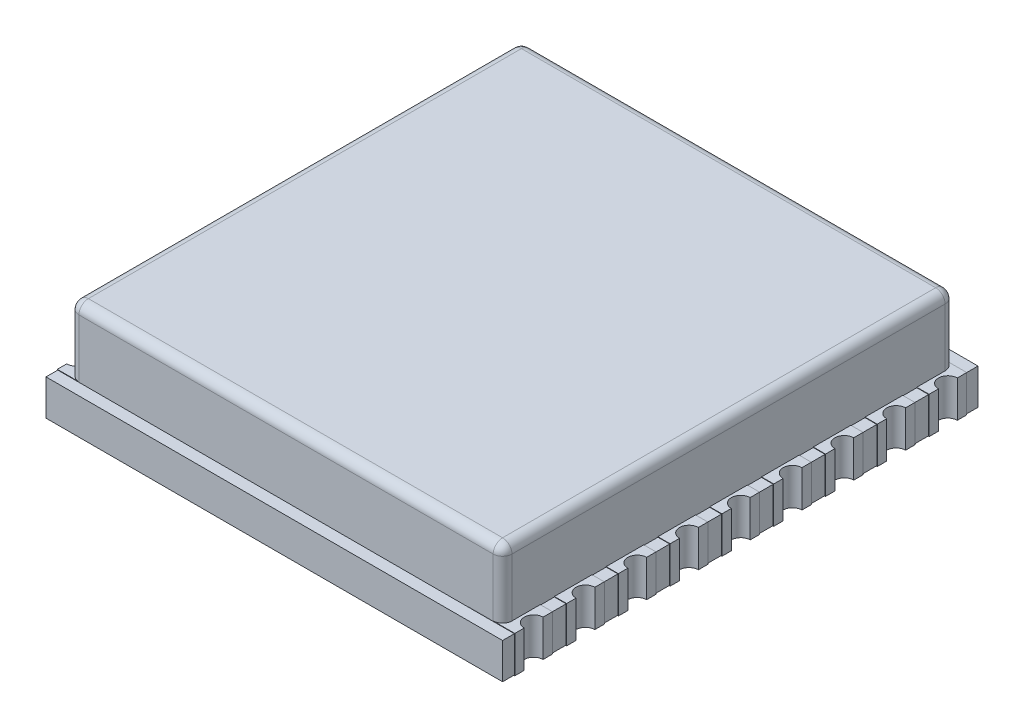
from build123d import *

# Parameters (mm, degrees)
SKETCH1_W              = 9.7
SKETCH1_H              = 10.1
BOSS_EXTRUDE1_DEPTH    = 0.76
CUT_EXTRUDE1_REACH     = 9.043
SKETCH2_R              = 0.25
BOSS_EXTRUDE2_START    = 0.01
SKETCH3_W              = 1
SKETCH3_H              = 0.8
BOSS_EXTRUDE2_DEPTH    = 0.78
BOSS_EXTRUDE2_2_DEPTH  = 0.78
BOSS_EXTRUDE2_3_DEPTH  = 0.78
BOSS_EXTRUDE2_4_DEPTH  = 0.78
BOSS_EXTRUDE2_5_DEPTH  = 0.78
BOSS_EXTRUDE2_6_DEPTH  = 0.78
BOSS_EXTRUDE2_7_DEPTH  = 0.78
BOSS_EXTRUDE2_8_DEPTH  = 0.78
BOSS_EXTRUDE2_9_DEPTH  = 0.78
BOSS_EXTRUDE2_10_DEPTH = 0.78
BOSS_EXTRUDE2_11_DEPTH = 0.78
BOSS_EXTRUDE2_12_DEPTH = 0.78
BOSS_EXTRUDE2_13_DEPTH = 0.78
BOSS_EXTRUDE2_14_DEPTH = 0.78
BOSS_EXTRUDE2_15_DEPTH = 0.78
BOSS_EXTRUDE2_16_DEPTH = 0.78
BOSS_EXTRUDE2_17_DEPTH = 0.78
BOSS_EXTRUDE2_18_DEPTH = 0.78
SKETCH4_R              = 0.2
CUT_EXTRUDE2_DEPTH     = 8.051985536
SKETCH5_W              = 9.2
SKETCH5_H              = 9.6
BOSS_EXTRUDE3_DEPTH    = 1.44
FILLET1_R              = 0.2
SHELL1_START           = -4.6
SHELL1_OUTLINE_W       = 8.8
SHELL1_OUTLINE_H       = 1.24
SHELL1_DEPTH           = 9.2


# Read off the part's stored shape, not the designer's step: Shell1
with BuildPart() as part:
    # Sketch1 → Boss-Extrude1 (new body)
    with BuildSketch(Plane(origin=(0, 0, 0), x_dir=(1, 0, 0), z_dir=(0, 1, 0))):
        Rectangle(SKETCH1_W, SKETCH1_H)
    extrude(amount=BOSS_EXTRUDE1_DEPTH)

    # Sketch2 → Cut-Extrude1 (cut, up to next)
    with BuildSketch(Plane(origin=(0, 0.76, 0), x_dir=(1, 0, 0), z_dir=(0, 1, 0)), mode=Mode.PRIVATE) as cut_extrude1_sk1:
        with Locations((-4.85, 4.4)):
            Circle(SKETCH2_R)
    cut_extrude1_tool1 = extrude(cut_extrude1_sk1.sketch, amount=-CUT_EXTRUDE1_REACH, mode=Mode.PRIVATE) & part.part
    # Sketch2 → Cut-Extrude1 (cut, up to next)
    with BuildSketch(Plane(origin=(0, 0.76, 0), x_dir=(1, 0, 0), z_dir=(0, 1, 0)), mode=Mode.PRIVATE) as cut_extrude1_sk2:
        with Locations((-4.85, 3.3)):
            Circle(SKETCH2_R)
    cut_extrude1_tool2 = extrude(cut_extrude1_sk2.sketch, amount=-CUT_EXTRUDE1_REACH, mode=Mode.PRIVATE) & part.part
    # Sketch2 → Cut-Extrude1 (cut, up to next)
    with BuildSketch(Plane(origin=(0, 0.76, 0), x_dir=(1, 0, 0), z_dir=(0, 1, 0)), mode=Mode.PRIVATE) as cut_extrude1_sk3:
        with Locations((-4.85, 2.2)):
            Circle(SKETCH2_R)
    cut_extrude1_tool3 = extrude(cut_extrude1_sk3.sketch, amount=-CUT_EXTRUDE1_REACH, mode=Mode.PRIVATE) & part.part
    # Sketch2 → Cut-Extrude1 (cut, up to next)
    with BuildSketch(Plane(origin=(0, 0.76, 0), x_dir=(1, 0, 0), z_dir=(0, 1, 0)), mode=Mode.PRIVATE) as cut_extrude1_sk4:
        with Locations((-4.85, 1.1)):
            Circle(SKETCH2_R)
    cut_extrude1_tool4 = extrude(cut_extrude1_sk4.sketch, amount=-CUT_EXTRUDE1_REACH, mode=Mode.PRIVATE) & part.part
    # Sketch2 → Cut-Extrude1 (cut, up to next)
    with BuildSketch(Plane(origin=(0, 0.76, 0), x_dir=(1, 0, 0), z_dir=(0, 1, 0)), mode=Mode.PRIVATE) as cut_extrude1_sk5:
        with Locations((-4.85, 0)):
            Circle(SKETCH2_R)
    cut_extrude1_tool5 = extrude(cut_extrude1_sk5.sketch, amount=-CUT_EXTRUDE1_REACH, mode=Mode.PRIVATE) & part.part
    # Sketch2 → Cut-Extrude1 (cut, up to next)
    with BuildSketch(Plane(origin=(0, 0.76, 0), x_dir=(1, 0, 0), z_dir=(0, 1, 0)), mode=Mode.PRIVATE) as cut_extrude1_sk6:
        with Locations((-4.85, -1.1)):
            Circle(SKETCH2_R)
    cut_extrude1_tool6 = extrude(cut_extrude1_sk6.sketch, amount=-CUT_EXTRUDE1_REACH, mode=Mode.PRIVATE) & part.part
    # Sketch2 → Cut-Extrude1 (cut, up to next)
    with BuildSketch(Plane(origin=(0, 0.76, 0), x_dir=(1, 0, 0), z_dir=(0, 1, 0)), mode=Mode.PRIVATE) as cut_extrude1_sk7:
        with Locations((-4.85, -2.2)):
            Circle(SKETCH2_R)
    cut_extrude1_tool7 = extrude(cut_extrude1_sk7.sketch, amount=-CUT_EXTRUDE1_REACH, mode=Mode.PRIVATE) & part.part
    # Sketch2 → Cut-Extrude1 (cut, up to next)
    with BuildSketch(Plane(origin=(0, 0.76, 0), x_dir=(1, 0, 0), z_dir=(0, 1, 0)), mode=Mode.PRIVATE) as cut_extrude1_sk8:
        with Locations((-4.85, -3.3)):
            Circle(SKETCH2_R)
    cut_extrude1_tool8 = extrude(cut_extrude1_sk8.sketch, amount=-CUT_EXTRUDE1_REACH, mode=Mode.PRIVATE) & part.part
    # Sketch2 → Cut-Extrude1 (cut, up to next)
    with BuildSketch(Plane(origin=(0, 0.76, 0), x_dir=(1, 0, 0), z_dir=(0, 1, 0)), mode=Mode.PRIVATE) as cut_extrude1_sk9:
        with Locations((-4.85, -4.4)):
            Circle(SKETCH2_R)
    cut_extrude1_tool9 = extrude(cut_extrude1_sk9.sketch, amount=-CUT_EXTRUDE1_REACH, mode=Mode.PRIVATE) & part.part
    # Sketch2 → Cut-Extrude1 (cut, up to next)
    with BuildSketch(Plane(origin=(0, 0.76, 0), x_dir=(1, 0, 0), z_dir=(0, 1, 0)), mode=Mode.PRIVATE) as cut_extrude1_sk10:
        with Locations((4.85, -4.4)):
            Circle(SKETCH2_R)
    cut_extrude1_tool10 = extrude(cut_extrude1_sk10.sketch, amount=-CUT_EXTRUDE1_REACH, mode=Mode.PRIVATE) & part.part
    # Sketch2 → Cut-Extrude1 (cut, up to next)
    with BuildSketch(Plane(origin=(0, 0.76, 0), x_dir=(1, 0, 0), z_dir=(0, 1, 0)), mode=Mode.PRIVATE) as cut_extrude1_sk11:
        with Locations((4.85, -3.3)):
            Circle(SKETCH2_R)
    cut_extrude1_tool11 = extrude(cut_extrude1_sk11.sketch, amount=-CUT_EXTRUDE1_REACH, mode=Mode.PRIVATE) & part.part
    # Sketch2 → Cut-Extrude1 (cut, up to next)
    with BuildSketch(Plane(origin=(0, 0.76, 0), x_dir=(1, 0, 0), z_dir=(0, 1, 0)), mode=Mode.PRIVATE) as cut_extrude1_sk12:
        with Locations((4.85, -2.2)):
            Circle(SKETCH2_R)
    cut_extrude1_tool12 = extrude(cut_extrude1_sk12.sketch, amount=-CUT_EXTRUDE1_REACH, mode=Mode.PRIVATE) & part.part
    # Sketch2 → Cut-Extrude1 (cut, up to next)
    with BuildSketch(Plane(origin=(0, 0.76, 0), x_dir=(1, 0, 0), z_dir=(0, 1, 0)), mode=Mode.PRIVATE) as cut_extrude1_sk13:
        with Locations((4.85, -1.1)):
            Circle(SKETCH2_R)
    cut_extrude1_tool13 = extrude(cut_extrude1_sk13.sketch, amount=-CUT_EXTRUDE1_REACH, mode=Mode.PRIVATE) & part.part
    # Sketch2 → Cut-Extrude1 (cut, up to next)
    with BuildSketch(Plane(origin=(0, 0.76, 0), x_dir=(1, 0, 0), z_dir=(0, 1, 0)), mode=Mode.PRIVATE) as cut_extrude1_sk14:
        with Locations((4.85, 0)):
            Circle(SKETCH2_R)
    cut_extrude1_tool14 = extrude(cut_extrude1_sk14.sketch, amount=-CUT_EXTRUDE1_REACH, mode=Mode.PRIVATE) & part.part
    # Sketch2 → Cut-Extrude1 (cut, up to next)
    with BuildSketch(Plane(origin=(0, 0.76, 0), x_dir=(1, 0, 0), z_dir=(0, 1, 0)), mode=Mode.PRIVATE) as cut_extrude1_sk15:
        with Locations((4.85, 1.1)):
            Circle(SKETCH2_R)
    cut_extrude1_tool15 = extrude(cut_extrude1_sk15.sketch, amount=-CUT_EXTRUDE1_REACH, mode=Mode.PRIVATE) & part.part
    # Sketch2 → Cut-Extrude1 (cut, up to next)
    with BuildSketch(Plane(origin=(0, 0.76, 0), x_dir=(1, 0, 0), z_dir=(0, 1, 0)), mode=Mode.PRIVATE) as cut_extrude1_sk16:
        with Locations((4.85, 2.2)):
            Circle(SKETCH2_R)
    cut_extrude1_tool16 = extrude(cut_extrude1_sk16.sketch, amount=-CUT_EXTRUDE1_REACH, mode=Mode.PRIVATE) & part.part
    # Sketch2 → Cut-Extrude1 (cut, up to next)
    with BuildSketch(Plane(origin=(0, 0.76, 0), x_dir=(1, 0, 0), z_dir=(0, 1, 0)), mode=Mode.PRIVATE) as cut_extrude1_sk17:
        with Locations((4.85, 3.3)):
            Circle(SKETCH2_R)
    cut_extrude1_tool17 = extrude(cut_extrude1_sk17.sketch, amount=-CUT_EXTRUDE1_REACH, mode=Mode.PRIVATE) & part.part
    # Sketch2 → Cut-Extrude1 (cut, up to next)
    with BuildSketch(Plane(origin=(0, 0.76, 0), x_dir=(1, 0, 0), z_dir=(0, 1, 0)), mode=Mode.PRIVATE) as cut_extrude1_sk18:
        with Locations((4.85, 4.4)):
            Circle(SKETCH2_R)
    cut_extrude1_tool18 = extrude(cut_extrude1_sk18.sketch, amount=-CUT_EXTRUDE1_REACH, mode=Mode.PRIVATE) & part.part
    add(cut_extrude1_tool1.solids().sort_by_distance((-4.85, 0.76, -4.4))[0], mode=Mode.SUBTRACT)
    add(cut_extrude1_tool2.solids().sort_by_distance((-4.85, 0.76, -3.3))[0], mode=Mode.SUBTRACT)
    add(cut_extrude1_tool3.solids().sort_by_distance((-4.85, 0.76, -2.2))[0], mode=Mode.SUBTRACT)
    add(cut_extrude1_tool4.solids().sort_by_distance((-4.85, 0.76, -1.1))[0], mode=Mode.SUBTRACT)
    add(cut_extrude1_tool5.solids().sort_by_distance((-4.85, 0.76, 0))[0], mode=Mode.SUBTRACT)
    add(cut_extrude1_tool6.solids().sort_by_distance((-4.85, 0.76, 1.1))[0], mode=Mode.SUBTRACT)
    add(cut_extrude1_tool7.solids().sort_by_distance((-4.85, 0.76, 2.2))[0], mode=Mode.SUBTRACT)
    add(cut_extrude1_tool8.solids().sort_by_distance((-4.85, 0.76, 3.3))[0], mode=Mode.SUBTRACT)
    add(cut_extrude1_tool9.solids().sort_by_distance((-4.85, 0.76, 4.4))[0], mode=Mode.SUBTRACT)
    add(cut_extrude1_tool10.solids().sort_by_distance((4.85, 0.76, 4.4))[0], mode=Mode.SUBTRACT)
    add(cut_extrude1_tool11.solids().sort_by_distance((4.85, 0.76, 3.3))[0], mode=Mode.SUBTRACT)
    add(cut_extrude1_tool12.solids().sort_by_distance((4.85, 0.76, 2.2))[0], mode=Mode.SUBTRACT)
    add(cut_extrude1_tool13.solids().sort_by_distance((4.85, 0.76, 1.1))[0], mode=Mode.SUBTRACT)
    add(cut_extrude1_tool14.solids().sort_by_distance((4.85, 0.76, 0))[0], mode=Mode.SUBTRACT)
    add(cut_extrude1_tool15.solids().sort_by_distance((4.85, 0.76, -1.1))[0], mode=Mode.SUBTRACT)
    add(cut_extrude1_tool16.solids().sort_by_distance((4.85, 0.76, -2.2))[0], mode=Mode.SUBTRACT)
    add(cut_extrude1_tool17.solids().sort_by_distance((4.85, 0.76, -3.3))[0], mode=Mode.SUBTRACT)
    add(cut_extrude1_tool18.solids().sort_by_distance((4.85, 0.76, -4.4))[0], mode=Mode.SUBTRACT)


with BuildPart() as body_2:
    # Sketch3 → Boss-Extrude2 (new body)
    with BuildSketch(Plane(origin=(0, 0.76, 0), x_dir=(1, 0, 0), z_dir=(0, 1, 0)).offset(BOSS_EXTRUDE2_START)):
        with Locations((-4.36, 4.4)):
            Rectangle(SKETCH3_W, SKETCH3_H)
    extrude(amount=-BOSS_EXTRUDE2_DEPTH)


with BuildPart() as body_3:
    # Sketch3 → Boss-Extrude2 2 (new body)
    with BuildSketch(Plane(origin=(0, 0.76, 0), x_dir=(1, 0, 0), z_dir=(0, 1, 0)).offset(BOSS_EXTRUDE2_START)):
        with Locations((-4.36, 3.3)):
            Rectangle(SKETCH3_W, SKETCH3_H)
    extrude(amount=-BOSS_EXTRUDE2_2_DEPTH)


with BuildPart() as body_4:
    # Sketch3 → Boss-Extrude2 3 (new body)
    with BuildSketch(Plane(origin=(0, 0.76, 0), x_dir=(1, 0, 0), z_dir=(0, 1, 0)).offset(BOSS_EXTRUDE2_START)):
        with Locations((-4.36, 2.2)):
            Rectangle(SKETCH3_W, SKETCH3_H)
    extrude(amount=-BOSS_EXTRUDE2_3_DEPTH)


with BuildPart() as body_5:
    # Sketch3 → Boss-Extrude2 4 (new body)
    with BuildSketch(Plane(origin=(0, 0.76, 0), x_dir=(1, 0, 0), z_dir=(0, 1, 0)).offset(BOSS_EXTRUDE2_START)):
        with Locations((-4.36, 1.1)):
            Rectangle(SKETCH3_W, SKETCH3_H)
    extrude(amount=-BOSS_EXTRUDE2_4_DEPTH)


with BuildPart() as body_6:
    # Sketch3 → Boss-Extrude2 5 (new body)
    with BuildSketch(Plane(origin=(0, 0.76, 0), x_dir=(1, 0, 0), z_dir=(0, 1, 0)).offset(BOSS_EXTRUDE2_START)):
        with Locations((-4.36, 0)):
            Rectangle(SKETCH3_W, SKETCH3_H)
    extrude(amount=-BOSS_EXTRUDE2_5_DEPTH)


with BuildPart() as body_7:
    # Sketch3 → Boss-Extrude2 6 (new body)
    with BuildSketch(Plane(origin=(0, 0.76, 0), x_dir=(1, 0, 0), z_dir=(0, 1, 0)).offset(BOSS_EXTRUDE2_START)):
        with Locations((-4.36, -1.1)):
            Rectangle(SKETCH3_W, SKETCH3_H)
    extrude(amount=-BOSS_EXTRUDE2_6_DEPTH)


with BuildPart() as body_8:
    # Sketch3 → Boss-Extrude2 7 (new body)
    with BuildSketch(Plane(origin=(0, 0.76, 0), x_dir=(1, 0, 0), z_dir=(0, 1, 0)).offset(BOSS_EXTRUDE2_START)):
        with Locations((-4.36, -2.2)):
            Rectangle(SKETCH3_W, SKETCH3_H)
    extrude(amount=-BOSS_EXTRUDE2_7_DEPTH)


with BuildPart() as body_9:
    # Sketch3 → Boss-Extrude2 8 (new body)
    with BuildSketch(Plane(origin=(0, 0.76, 0), x_dir=(1, 0, 0), z_dir=(0, 1, 0)).offset(BOSS_EXTRUDE2_START)):
        with Locations((-4.36, -3.3)):
            Rectangle(SKETCH3_W, SKETCH3_H)
    extrude(amount=-BOSS_EXTRUDE2_8_DEPTH)


with BuildPart() as body_10:
    # Sketch3 → Boss-Extrude2 9 (new body)
    with BuildSketch(Plane(origin=(0, 0.76, 0), x_dir=(1, 0, 0), z_dir=(0, 1, 0)).offset(BOSS_EXTRUDE2_START)):
        with Locations((-4.36, -4.4)):
            Rectangle(SKETCH3_W, SKETCH3_H)
    extrude(amount=-BOSS_EXTRUDE2_9_DEPTH)


with BuildPart() as body_11:
    # Sketch3 → Boss-Extrude2 10 (new body)
    with BuildSketch(Plane(origin=(0, 0.76, 0), x_dir=(1, 0, 0), z_dir=(0, 1, 0)).offset(BOSS_EXTRUDE2_START)):
        with Locations((4.36, -4.4)):
            Rectangle(SKETCH3_W, SKETCH3_H)
    extrude(amount=-BOSS_EXTRUDE2_10_DEPTH)


with BuildPart() as body_12:
    # Sketch3 → Boss-Extrude2 11 (new body)
    with BuildSketch(Plane(origin=(0, 0.76, 0), x_dir=(1, 0, 0), z_dir=(0, 1, 0)).offset(BOSS_EXTRUDE2_START)):
        with Locations((4.36, -3.3)):
            Rectangle(SKETCH3_W, SKETCH3_H)
    extrude(amount=-BOSS_EXTRUDE2_11_DEPTH)


with BuildPart() as body_13:
    # Sketch3 → Boss-Extrude2 12 (new body)
    with BuildSketch(Plane(origin=(0, 0.76, 0), x_dir=(1, 0, 0), z_dir=(0, 1, 0)).offset(BOSS_EXTRUDE2_START)):
        with Locations((4.36, -2.2)):
            Rectangle(SKETCH3_W, SKETCH3_H)
    extrude(amount=-BOSS_EXTRUDE2_12_DEPTH)


with BuildPart() as body_14:
    # Sketch3 → Boss-Extrude2 13 (new body)
    with BuildSketch(Plane(origin=(0, 0.76, 0), x_dir=(1, 0, 0), z_dir=(0, 1, 0)).offset(BOSS_EXTRUDE2_START)):
        with Locations((4.36, -1.1)):
            Rectangle(SKETCH3_W, SKETCH3_H)
    extrude(amount=-BOSS_EXTRUDE2_13_DEPTH)


with BuildPart() as body_15:
    # Sketch3 → Boss-Extrude2 14 (new body)
    with BuildSketch(Plane(origin=(0, 0.76, 0), x_dir=(1, 0, 0), z_dir=(0, 1, 0)).offset(BOSS_EXTRUDE2_START)):
        with Locations((4.36, 0)):
            Rectangle(SKETCH3_W, SKETCH3_H)
    extrude(amount=-BOSS_EXTRUDE2_14_DEPTH)


with BuildPart() as body_16:
    # Sketch3 → Boss-Extrude2 15 (new body)
    with BuildSketch(Plane(origin=(0, 0.76, 0), x_dir=(1, 0, 0), z_dir=(0, 1, 0)).offset(BOSS_EXTRUDE2_START)):
        with Locations((4.36, 1.1)):
            Rectangle(SKETCH3_W, SKETCH3_H)
    extrude(amount=-BOSS_EXTRUDE2_15_DEPTH)


with BuildPart() as body_17:
    # Sketch3 → Boss-Extrude2 16 (new body)
    with BuildSketch(Plane(origin=(0, 0.76, 0), x_dir=(1, 0, 0), z_dir=(0, 1, 0)).offset(BOSS_EXTRUDE2_START)):
        with Locations((4.36, 2.2)):
            Rectangle(SKETCH3_W, SKETCH3_H)
    extrude(amount=-BOSS_EXTRUDE2_16_DEPTH)


with BuildPart() as body_18:
    # Sketch3 → Boss-Extrude2 17 (new body)
    with BuildSketch(Plane(origin=(0, 0.76, 0), x_dir=(1, 0, 0), z_dir=(0, 1, 0)).offset(BOSS_EXTRUDE2_START)):
        with Locations((4.36, 3.3)):
            Rectangle(SKETCH3_W, SKETCH3_H)
    extrude(amount=-BOSS_EXTRUDE2_17_DEPTH)


with BuildPart() as body_19:
    # Sketch3 → Boss-Extrude2 18 (new body)
    with BuildSketch(Plane(origin=(0, 0.76, 0), x_dir=(1, 0, 0), z_dir=(0, 1, 0)).offset(BOSS_EXTRUDE2_START)):
        with Locations((4.36, 4.4)):
            Rectangle(SKETCH3_W, SKETCH3_H)
    extrude(amount=-BOSS_EXTRUDE2_18_DEPTH)


with BuildPart() as cut_extrude2_tool:
    # Sketch4 → Cut-Extrude2 (new, through all)
    with BuildSketch(Plane(origin=(0, 0.77, 0), x_dir=(1, 0, 0), z_dir=(0, 1, 0))):
        with Locations((-4.86, 4.4)):
            Circle(SKETCH4_R)
        with Locations((-4.86, 3.3)):
            Circle(SKETCH4_R)
        with Locations((-4.86, 2.2)):
            Circle(SKETCH4_R)
        with Locations((-4.86, 1.1)):
            Circle(SKETCH4_R)
        with Locations((-4.86, 0)):
            Circle(SKETCH4_R)
        with Locations((-4.86, -1.1)):
            Circle(SKETCH4_R)
        with Locations((-4.86, -2.2)):
            Circle(SKETCH4_R)
        with Locations((-4.86, -3.3)):
            Circle(SKETCH4_R)
        with Locations((-4.86, -4.4)):
            Circle(SKETCH4_R)
        with Locations((4.86, -4.4)):
            Circle(SKETCH4_R)
        with Locations((4.86, -3.3)):
            Circle(SKETCH4_R)
        with Locations((4.86, -2.2)):
            Circle(SKETCH4_R)
        with Locations((4.86, -1.1)):
            Circle(SKETCH4_R)
        with Locations((4.86, 0)):
            Circle(SKETCH4_R)
        with Locations((4.86, 1.1)):
            Circle(SKETCH4_R)
        with Locations((4.86, 2.2)):
            Circle(SKETCH4_R)
        with Locations((4.86, 3.3)):
            Circle(SKETCH4_R)
        with Locations((4.86, 4.4)):
            Circle(SKETCH4_R)
    extrude(amount=-CUT_EXTRUDE2_DEPTH)


with BuildPart() as body_2_1:
    add(body_2.part)

    # Cut-Extrude2: cut by cut_extrude2_tool
    add(cut_extrude2_tool.part, mode=Mode.SUBTRACT)


with BuildPart() as body_3_1:
    add(body_3.part)

    # Cut-Extrude2: cut by cut_extrude2_tool
    add(cut_extrude2_tool.part, mode=Mode.SUBTRACT)


with BuildPart() as body_4_1:
    add(body_4.part)

    # Cut-Extrude2: cut by cut_extrude2_tool
    add(cut_extrude2_tool.part, mode=Mode.SUBTRACT)


with BuildPart() as body_5_1:
    add(body_5.part)

    # Cut-Extrude2: cut by cut_extrude2_tool
    add(cut_extrude2_tool.part, mode=Mode.SUBTRACT)


with BuildPart() as body_6_1:
    add(body_6.part)

    # Cut-Extrude2: cut by cut_extrude2_tool
    add(cut_extrude2_tool.part, mode=Mode.SUBTRACT)


with BuildPart() as body_7_1:
    add(body_7.part)

    # Cut-Extrude2: cut by cut_extrude2_tool
    add(cut_extrude2_tool.part, mode=Mode.SUBTRACT)


with BuildPart() as body_8_1:
    add(body_8.part)

    # Cut-Extrude2: cut by cut_extrude2_tool
    add(cut_extrude2_tool.part, mode=Mode.SUBTRACT)


with BuildPart() as body_9_1:
    add(body_9.part)

    # Cut-Extrude2: cut by cut_extrude2_tool
    add(cut_extrude2_tool.part, mode=Mode.SUBTRACT)


with BuildPart() as body_10_1:
    add(body_10.part)

    # Cut-Extrude2: cut by cut_extrude2_tool
    add(cut_extrude2_tool.part, mode=Mode.SUBTRACT)


with BuildPart() as body_11_1:
    add(body_11.part)

    # Cut-Extrude2: cut by cut_extrude2_tool
    add(cut_extrude2_tool.part, mode=Mode.SUBTRACT)


with BuildPart() as body_12_1:
    add(body_12.part)

    # Cut-Extrude2: cut by cut_extrude2_tool
    add(cut_extrude2_tool.part, mode=Mode.SUBTRACT)


with BuildPart() as body_13_1:
    add(body_13.part)

    # Cut-Extrude2: cut by cut_extrude2_tool
    add(cut_extrude2_tool.part, mode=Mode.SUBTRACT)


with BuildPart() as body_14_1:
    add(body_14.part)

    # Cut-Extrude2: cut by cut_extrude2_tool
    add(cut_extrude2_tool.part, mode=Mode.SUBTRACT)


with BuildPart() as body_15_1:
    add(body_15.part)

    # Cut-Extrude2: cut by cut_extrude2_tool
    add(cut_extrude2_tool.part, mode=Mode.SUBTRACT)


with BuildPart() as body_16_1:
    add(body_16.part)

    # Cut-Extrude2: cut by cut_extrude2_tool
    add(cut_extrude2_tool.part, mode=Mode.SUBTRACT)


with BuildPart() as body_17_1:
    add(body_17.part)

    # Cut-Extrude2: cut by cut_extrude2_tool
    add(cut_extrude2_tool.part, mode=Mode.SUBTRACT)


with BuildPart() as body_18_1:
    add(body_18.part)

    # Cut-Extrude2: cut by cut_extrude2_tool
    add(cut_extrude2_tool.part, mode=Mode.SUBTRACT)


with BuildPart() as body_19_1:
    add(body_19.part)

    # Cut-Extrude2: cut by cut_extrude2_tool
    add(cut_extrude2_tool.part, mode=Mode.SUBTRACT)


with BuildPart() as body_20:
    # Sketch5 → Boss-Extrude3 (new body)
    with BuildSketch(Plane(origin=(0, 0.76, 0), x_dir=(1, 0, 0), z_dir=(0, 1, 0))):
        Rectangle(SKETCH5_W, SKETCH5_H)
    extrude(amount=BOSS_EXTRUDE3_DEPTH)

    # Fillet1
    fillet1_edges = [body_20.edges().sort_by_distance(p)[0] for p in [
        (-4.6, 2.2, 0),
        (0, 2.2, 4.8),
        (4.6, 2.2, 0),
        (4.6, 1.48, 4.8),
        (-4.6, 1.48, 4.8),
        (-4.6, 1.48, -4.8),
        (4.6, 1.48, -4.8),
        (0, 2.2, -4.8),
    ]]
    fillet(fillet1_edges, radius=FILLET1_R)

    # Shell1 outline → Shell1 (cut)
    with BuildSketch(Plane.XY.offset(SHELL1_START)):
        with Locations((0, 1.38)):
            Rectangle(SHELL1_OUTLINE_W, SHELL1_OUTLINE_H)
    extrude(amount=SHELL1_DEPTH, mode=Mode.SUBTRACT)


solid = Compound([part.part, body_2_1.part, body_3_1.part, body_4_1.part, body_5_1.part, body_6_1.part, body_7_1.part, body_8_1.part, body_9_1.part, body_10_1.part, body_11_1.part, body_12_1.part, body_13_1.part, body_14_1.part, body_15_1.part, body_16_1.part, body_17_1.part, body_18_1.part, body_19_1.part, body_20.part])
